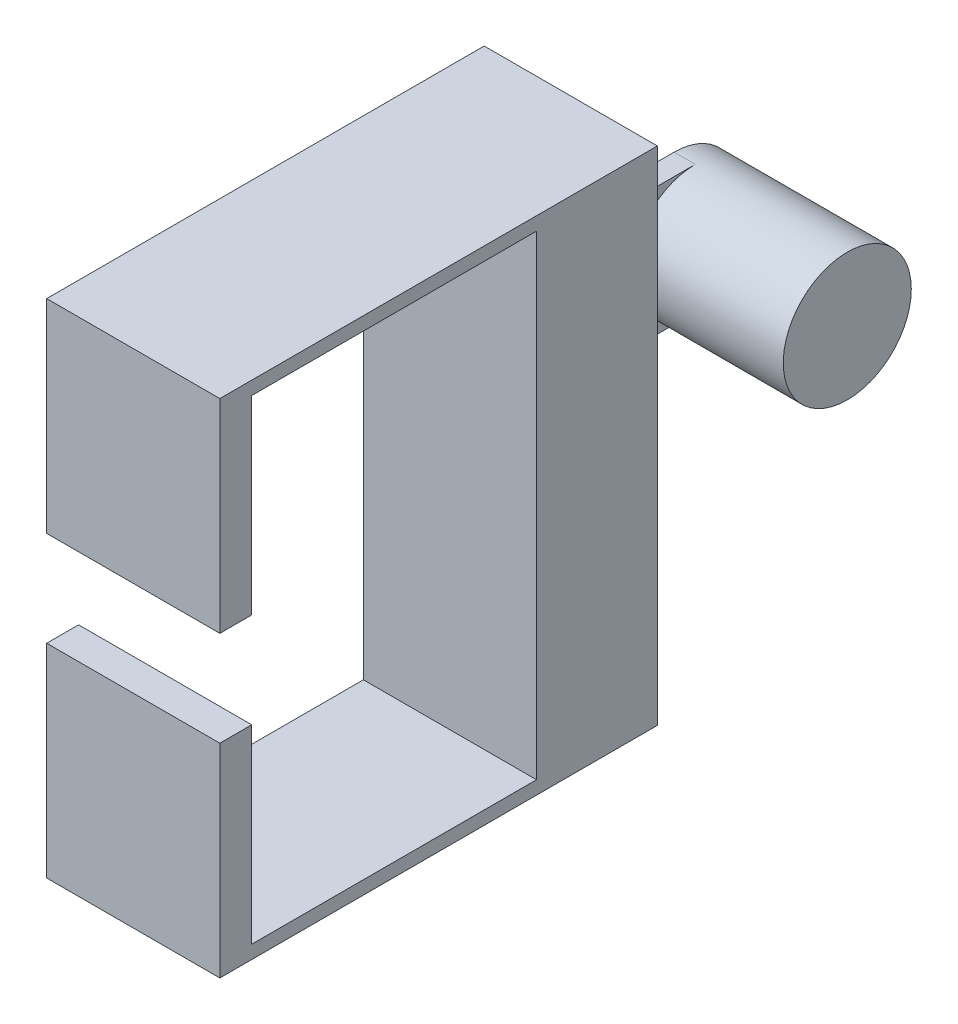
from build123d import *

# Parameters (mm, degrees)
BOSS_EXTRUDE1_DEPTH      = 20.32
BOSS_EXTRUDE2_START      = -2.833688097
BOSS_EXTRUDE2_DEPTH      = 2.833688097
BOSS_EXTRUDE3_DEPTH      = 20.32
BOSS_EXTRUDE3_DEPTH_BACK = 2.833688097


with BuildPart() as part:
    # Sketch1 → Boss-Extrude1 (new body)
    with BuildSketch(Plane.YZ):
        with BuildLine():
            ThreePointArc((8.562349171, 0), (0, 8.562349171), (-8.562349171, 0))
            ThreePointArc((-8.562349171, 0), (0, -8.562349171), (8.562349171, 0))
        make_face()
    extrude(amount=BOSS_EXTRUDE1_DEPTH)

    # Sketch1<5> → Boss-Extrude2 (add)
    with BuildSketch(Plane.YZ.offset(BOSS_EXTRUDE2_START)):
        with BuildLine():
            Line((8.562349171, 25.4), (-8.562349171, 25.4))
            Line((-8.562349171, 25.4), (-8.562349171, 0))
            ThreePointArc((-8.562349171, 0), (0, -8.562349171), (8.562349171, 0))
            Line((8.562349171, 0), (8.562349171, 25.4))
        make_face()
    extrude(amount=BOSS_EXTRUDE2_DEPTH)

    # Sketch1<6> → Boss-Extrude3 (add, two sides: drawn at the far end of the back side and taken through both)
    with BuildSketch(Plane.YZ.offset(-BOSS_EXTRUDE3_DEPTH_BACK)):
        Polygon((-6.36016, 79.644886138), (-6.36016, 83.9097483), (-33.554191153, 83.9097483), (-33.554191153, 25.4), (-8.562349171, 25.4), (8.562349171, 25.4), (33.554191153, 25.4), (33.554191153, 83.9097483), (6.36016, 83.9097483), (6.36016, 79.644886138), (31.77032, 79.644886138), (31.77032, 41.557586138), (-31.77032, 41.557586138), (-31.77032, 79.644886138), align=None)
    extrude(amount=BOSS_EXTRUDE3_DEPTH + BOSS_EXTRUDE3_DEPTH_BACK)


solid = part.part
